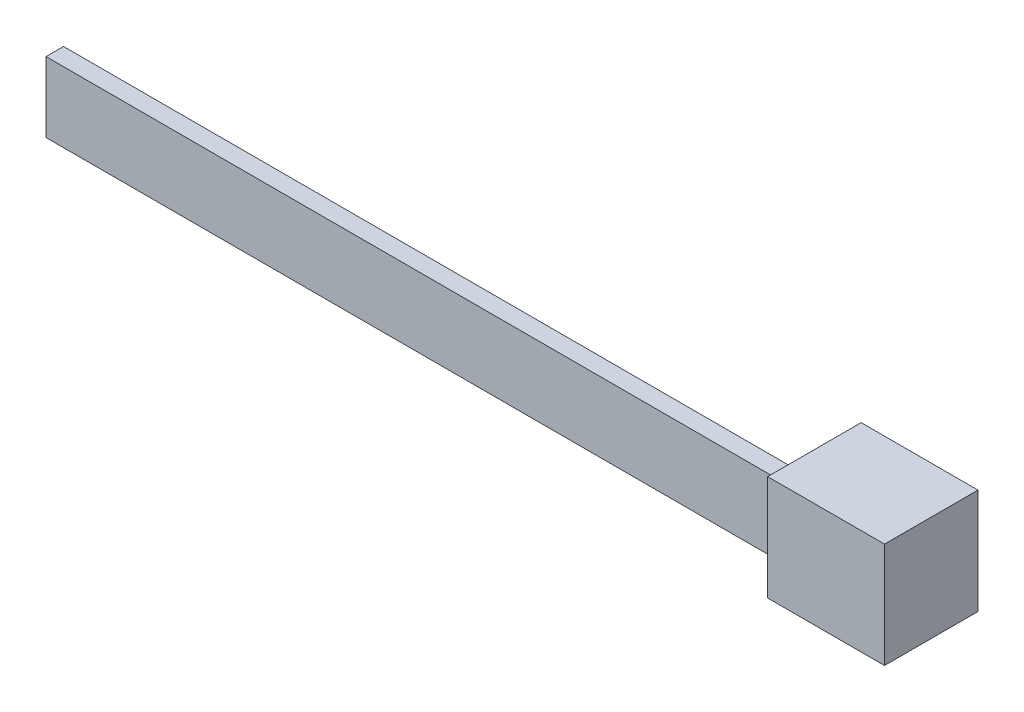
from build123d import *

# Parameters (mm, degrees)
BOSS_EXTRUDE1_DEPTH = 3
SKETCH2_W           = 10
SKETCH2_H           = 8
BOSS_EXTRUDE2_DEPTH = 3


with BuildPart() as part:
    # Sketch1 → Boss-Extrude1 (new, symmetric)
    with BuildSketch(Plane(origin=(0, 0, 0), x_dir=(1, 0, 0), z_dir=(0, 1, 0))):
        Polygon((0, -0.75), (0, -4), (10, -4), (10, 4), (0, 4), (0, 0.75), (-65, 0.75), (-65, -0.75), align=None)
    extrude(amount=BOSS_EXTRUDE1_DEPTH, both=True)

    # Sketch2 → Boss-Extrude2 (add)
    with BuildSketch(Plane(origin=(0, 3, 0), x_dir=(1, 0, 0), z_dir=(0, 1, 0))):
        with Locations((5, 0)):
            Rectangle(SKETCH2_W, SKETCH2_H)
    extrude(amount=BOSS_EXTRUDE2_DEPTH)


solid = part.part
